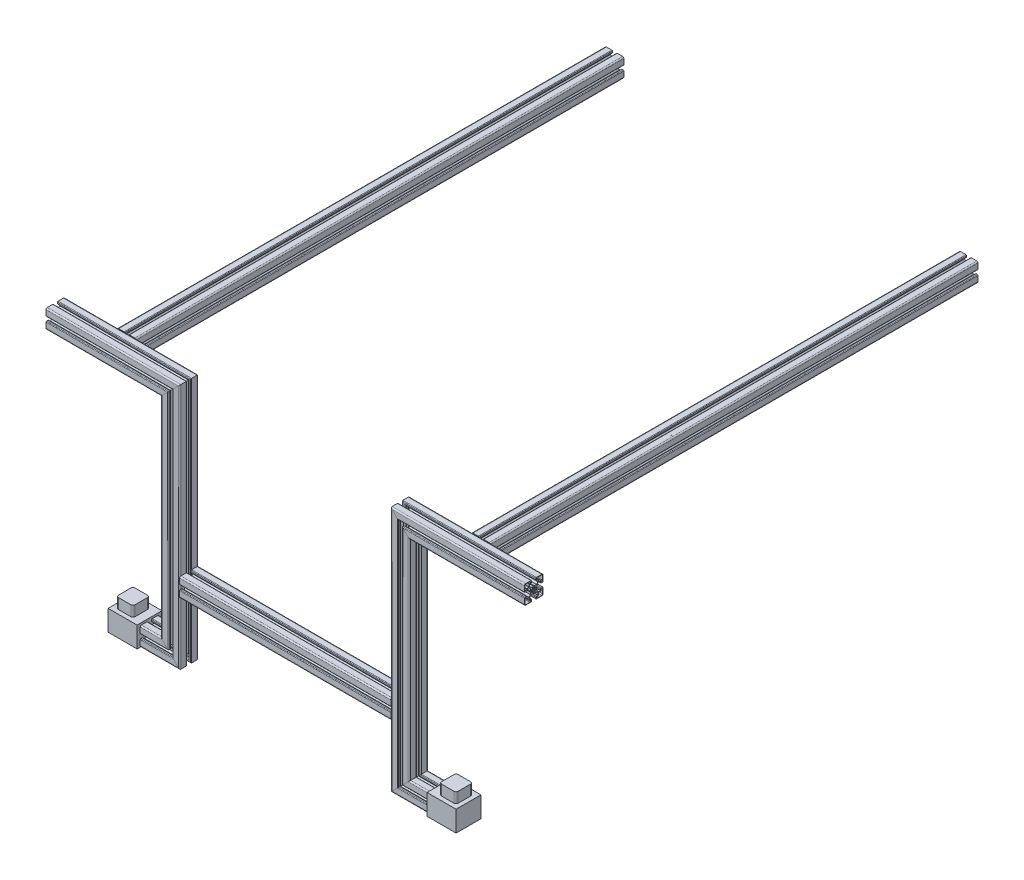
from build123d import *

# Parameters (mm, degrees)
SKETCH6_W            = 60
SKETCH6_H            = 50
BOSS_EXTRUDE3_DEPTH  = 70
SKETCH4_W            = 40
SKETCH4_H            = 40
RL_WHEEL_MOUNT_DEPTH = 25
FILLET1_R            = 5
BOSS_EXTRUDE5_DEPTH  = 254.9375
BOSS_EXTRUDE6_DEPTH  = 1177.476521782
FILLET1_OF_MIRROR2_R = 5


with BuildPart() as part:
    # Sweep3: sweep along a curve in space
    with BuildLine() as sweep3_path:
        Line((-420, 0, 0), (-277.5, 0, 0))
        Line((-277.5, 550, 0), (-277.5, 0, 0))
        Line((-277.5, 550, 0), (-577.5, 550, 0))
    # Sketch10 → Sweep3 (sweep)
    with BuildSketch(Plane(origin=(-420, 0, 0), x_dir=(0, 0, -1), z_dir=(1, 0, 0))):
        with BuildLine():
            Line((0.923478145, 7.9175), (0.023478218, 7.402351956))
            Line((0.023478218, 7.402351956), (-0.876521708, 7.9175))
            Line((-0.876521708, 7.9175), (-6.179846099, 7.9175))
            ThreePointArc((-6.179846099, 7.9175), (-6.325265803, 7.946425778), (-6.448546676, 8.028799423))
            Line((-6.448546676, 8.028799423), (-9.915222358, 11.495475106))
            ThreePointArc((-9.915222358, 11.495475106), (-9.997596004, 11.618755978), (-10.026521782, 11.764175683))
            Line((-10.026521782, 11.764175683), (-10.026521782, 16.0575))
            ThreePointArc((-10.026521782, 16.0575), (-9.915222358, 16.326200577), (-9.646521782, 16.4375))
            Line((-9.646521782, 16.4375), (-6.561521782, 16.4375))
            ThreePointArc((-6.561521782, 16.4375), (-5.486719474, 16.882697693), (-5.041521782, 17.9575))
            Line((-5.041521782, 17.9575), (-5.041521782, 20.9175))
            ThreePointArc((-5.041521782, 20.9175), (-5.486719474, 21.992302307), (-6.561521782, 22.4375))
            Line((-6.561521782, 22.4375), (-19.476521782, 22.4375))
            ThreePointArc((-19.476521782, 22.4375), (-21.597842125, 21.558820344), (-22.476521782, 19.4375))
            Line((-22.476521782, 19.4375), (-22.476521782, 6.5225))
            ThreePointArc((-22.476521782, 6.5225), (-22.031324089, 5.447697693), (-20.956521782, 5.0025))
            Line((-20.956521782, 5.0025), (-17.996521782, 5.0025))
            ThreePointArc((-17.996521782, 5.0025), (-16.921719474, 5.447697693), (-16.476521782, 6.5225))
            Line((-16.476521782, 6.5225), (-16.476521782, 9.6075))
            ThreePointArc((-16.476521782, 9.6075), (-16.365222358, 9.876200577), (-16.096521782, 9.9875))
            Line((-16.096521782, 9.9875), (-11.796126396, 9.9875))
            ThreePointArc((-11.796126396, 9.9875), (-11.650706692, 9.958574222), (-11.52742582, 9.876200577))
            Line((-11.52742582, 9.876200577), (-8.067821205, 6.416595962))
            ThreePointArc((-8.067821205, 6.416595962), (-7.985447559, 6.293315089), (-7.956521782, 6.147895385))
            Line((-7.956521782, 6.147895385), (-7.956521782, 0.837499635))
            Line((-7.956521782, 0.837499635), (-7.436908512, -0.0625))
            Line((-7.436908512, -0.0625), (-7.956521782, -0.962499635))
            Line((-7.956521782, -0.962499635), (-7.956521782, -6.265824317))
            ThreePointArc((-7.956521782, -6.265824317), (-7.985447559, -6.411244022), (-8.067821205, -6.534524894))
            Line((-8.067821205, -6.534524894), (-11.534496887, -10.001200577))
            ThreePointArc((-11.534496887, -10.001200577), (-11.65777776, -10.083574222), (-11.803197464, -10.1125))
            Line((-11.803197464, -10.1125), (-16.096521782, -10.1125))
            ThreePointArc((-16.096521782, -10.1125), (-16.365222358, -10.001200577), (-16.476521782, -9.7325))
            Line((-16.476521782, -9.7325), (-16.476521782, -6.6475))
            ThreePointArc((-16.476521782, -6.6475), (-16.921719474, -5.572697693), (-17.996521782, -5.1275))
            Line((-17.996521782, -5.1275), (-20.956521782, -5.1275))
            ThreePointArc((-20.956521782, -5.1275), (-22.031324089, -5.572697693), (-22.476521782, -6.6475))
            Line((-22.476521782, -6.6475), (-22.476521782, -19.5625))
            ThreePointArc((-22.476521782, -19.5625), (-21.597842125, -21.683820344), (-19.476521782, -22.5625))
            Line((-19.476521782, -22.5625), (-6.561521782, -22.5625))
            ThreePointArc((-6.561521782, -22.5625), (-5.486719474, -22.117302307), (-5.041521782, -21.0425))
            Line((-5.041521782, -21.0425), (-5.041521782, -18.0825))
            ThreePointArc((-5.041521782, -18.0825), (-5.486719474, -17.007697693), (-6.561521782, -16.5625))
            Line((-6.561521782, -16.5625), (-9.646521782, -16.5625))
            ThreePointArc((-9.646521782, -16.5625), (-9.915222358, -16.451200577), (-10.026521782, -16.1825))
            Line((-10.026521782, -16.1825), (-10.026521782, -11.882104615))
            ThreePointArc((-10.026521782, -11.882104615), (-9.997596004, -11.736684911), (-9.915222358, -11.613404038))
            Line((-9.915222358, -11.613404038), (-6.455617744, -8.153799423))
            ThreePointArc((-6.455617744, -8.153799423), (-6.332336871, -8.071425778), (-6.186917167, -8.0425))
            Line((-6.186917167, -8.0425), (-0.876521708, -8.0425))
            Line((-0.876521708, -8.0425), (0.023478218, -7.527351956))
            Line((0.023478218, -7.527351956), (0.923478145, -8.0425))
            Line((0.923478145, -8.0425), (6.226802536, -8.0425))
            ThreePointArc((6.226802536, -8.0425), (6.37222224, -8.071425778), (6.495503113, -8.153799423))
            Line((6.495503113, -8.153799423), (9.962178795, -11.620475106))
            ThreePointArc((9.962178795, -11.620475106), (10.044552441, -11.743755978), (10.073478218, -11.889175683))
            Line((10.073478218, -11.889175683), (10.073478218, -16.1825))
            ThreePointArc((10.073478218, -16.1825), (9.962178795, -16.451200577), (9.693478218, -16.5625))
            Line((9.693478218, -16.5625), (6.608478218, -16.5625))
            ThreePointArc((6.608478218, -16.5625), (5.533675911, -17.007697693), (5.088478218, -18.0825))
            Line((5.088478218, -18.0825), (5.088478218, -21.0425))
            ThreePointArc((5.088478218, -21.0425), (5.533675911, -22.117302307), (6.608478218, -22.5625))
            Line((6.608478218, -22.5625), (19.523478218, -22.5625))
            ThreePointArc((19.523478218, -22.5625), (21.644798562, -21.683820344), (22.523478218, -19.5625))
            Line((22.523478218, -19.5625), (22.523478218, -6.6475))
            ThreePointArc((22.523478218, -6.6475), (22.078280526, -5.572697693), (21.003478218, -5.1275))
            Line((21.003478218, -5.1275), (18.043478218, -5.1275))
            ThreePointArc((18.043478218, -5.1275), (16.968675911, -5.572697693), (16.523478218, -6.6475))
            Line((16.523478218, -6.6475), (16.523478218, -9.7325))
            ThreePointArc((16.523478218, -9.7325), (16.412178795, -10.001200577), (16.143478218, -10.1125))
            Line((16.143478218, -10.1125), (11.843082833, -10.1125))
            ThreePointArc((11.843082833, -10.1125), (11.697663129, -10.083574222), (11.574382256, -10.001200577))
            Line((11.574382256, -10.001200577), (8.114777642, -6.541595962))
            ThreePointArc((8.114777642, -6.541595962), (8.032403996, -6.418315089), (8.003478218, -6.272895385))
            Line((8.003478218, -6.272895385), (8.003478218, -0.962499635))
            Line((8.003478218, -0.962499635), (7.483864949, -0.0625))
            Line((7.483864949, -0.0625), (8.003478218, 0.837499635))
            Line((8.003478218, 0.837499635), (8.003478218, 6.140824317))
            ThreePointArc((8.003478218, 6.140824317), (8.032403996, 6.286244022), (8.114777642, 6.409524894))
            Line((8.114777642, 6.409524894), (11.581453324, 9.876200577))
            ThreePointArc((11.581453324, 9.876200577), (11.704734197, 9.958574222), (11.850153901, 9.9875))
            Line((11.850153901, 9.9875), (16.143478218, 9.9875))
            ThreePointArc((16.143478218, 9.9875), (16.412178795, 9.876200577), (16.523478218, 9.6075))
            Line((16.523478218, 9.6075), (16.523478218, 6.5225))
            ThreePointArc((16.523478218, 6.5225), (16.968675911, 5.447697693), (18.043478218, 5.0025))
            Line((18.043478218, 5.0025), (21.003478218, 5.0025))
            ThreePointArc((21.003478218, 5.0025), (22.078280526, 5.447697693), (22.523478218, 6.5225))
            Line((22.523478218, 6.5225), (22.523478218, 19.4375))
            ThreePointArc((22.523478218, 19.4375), (21.644798562, 21.558820344), (19.523478218, 22.4375))
            Line((19.523478218, 22.4375), (6.608478218, 22.4375))
            ThreePointArc((6.608478218, 22.4375), (5.533675911, 21.992302307), (5.088478218, 20.9175))
            Line((5.088478218, 20.9175), (5.088478218, 17.9575))
            ThreePointArc((5.088478218, 17.9575), (5.533675911, 16.882697693), (6.608478218, 16.4375))
            Line((6.608478218, 16.4375), (9.693478218, 16.4375))
            ThreePointArc((9.693478218, 16.4375), (9.962178795, 16.326200577), (10.073478218, 16.0575))
            Line((10.073478218, 16.0575), (10.073478218, 11.757104615))
            ThreePointArc((10.073478218, 11.757104615), (10.044552441, 11.611684911), (9.962178795, 11.488404038))
            Line((9.962178795, 11.488404038), (6.50257418, 8.028799423))
            ThreePointArc((6.50257418, 8.028799423), (6.379293308, 7.946425778), (6.233873604, 7.9175))
            Line((6.233873604, 7.9175), (0.923478145, 7.9175))
        make_face()
        with BuildLine():
            Line((9.9875, 17.976521782), (9.5475, 17.976521782))
            ThreePointArc((9.5475, 17.976521782), (8.486839828, 18.41586161), (8.0475, 19.476521782))
            Line((8.0475, 19.476521782), (8.0475, 19.976521782))
            ThreePointArc((8.0475, 19.976521782), (8.486839828, 21.037181953), (9.5475, 21.476521782))
            Line((9.5475, 21.476521782), (19.1575, 21.476521782))
            ThreePointArc((19.1575, 21.476521782), (20.769703461, 20.808725243), (21.4375, 19.196521782))
            Line((21.4375, 19.196521782), (21.4375, 9.586521782))
            ThreePointArc((21.4375, 9.586521782), (20.998160172, 8.52586161), (19.9375, 8.086521782))
            Line((19.9375, 8.086521782), (19.4375, 8.086521782))
            ThreePointArc((19.4375, 8.086521782), (18.376839828, 8.52586161), (17.9375, 9.586521782))
            Line((17.9375, 9.586521782), (17.9375, 10.026521782))
            ThreePointArc((17.9375, 10.026521782), (17.644606781, 10.733628563), (16.9375, 11.026521782))
            Line((16.9375, 11.026521782), (11.3675, 11.026521782))
            ThreePointArc((11.3675, 11.026521782), (11.098799423, 11.137821205), (10.9875, 11.406521782))
            Line((10.9875, 11.406521782), (10.9875, 16.976521782))
            ThreePointArc((10.9875, 16.976521782), (10.694606781, 17.683628563), (9.9875, 17.976521782))
        make_face(mode=Mode.SUBTRACT)
        with BuildLine():
            Line((17.976521782, -9.9875), (17.976521782, -9.5475))
            ThreePointArc((17.976521782, -9.5475), (18.41586161, -8.486839828), (19.476521782, -8.0475))
            Line((19.476521782, -8.0475), (19.976521782, -8.0475))
            ThreePointArc((19.976521782, -8.0475), (21.037181953, -8.486839828), (21.476521782, -9.5475))
            Line((21.476521782, -9.5475), (21.476521782, -19.1575))
            ThreePointArc((21.476521782, -19.1575), (20.808725243, -20.769703461), (19.196521782, -21.4375))
            Line((19.196521782, -21.4375), (9.586521782, -21.4375))
            ThreePointArc((9.586521782, -21.4375), (8.52586161, -20.998160172), (8.086521782, -19.9375))
            Line((8.086521782, -19.9375), (8.086521782, -19.4375))
            ThreePointArc((8.086521782, -19.4375), (8.52586161, -18.376839828), (9.586521782, -17.9375))
            Line((9.586521782, -17.9375), (10.026521782, -17.9375))
            ThreePointArc((10.026521782, -17.9375), (10.733628563, -17.644606781), (11.026521782, -16.9375))
            Line((11.026521782, -16.9375), (11.026521782, -11.3675))
            ThreePointArc((11.026521782, -11.3675), (11.137821205, -11.098799423), (11.406521782, -10.9875))
            Line((11.406521782, -10.9875), (16.976521782, -10.9875))
            ThreePointArc((16.976521782, -10.9875), (17.683628563, -10.694606781), (17.976521782, -9.9875))
        make_face(mode=Mode.SUBTRACT)
        with BuildLine():
            Line((-9.9875, -17.976521782), (-9.5475, -17.976521782))
            ThreePointArc((-9.5475, -17.976521782), (-8.486839828, -18.41586161), (-8.0475, -19.476521782))
            Line((-8.0475, -19.476521782), (-8.0475, -19.976521782))
            ThreePointArc((-8.0475, -19.976521782), (-8.486839828, -21.037181953), (-9.5475, -21.476521782))
            Line((-9.5475, -21.476521782), (-19.1575, -21.476521782))
            ThreePointArc((-19.1575, -21.476521782), (-20.769703461, -20.808725243), (-21.4375, -19.196521782))
            Line((-21.4375, -19.196521782), (-21.4375, -9.586521782))
            ThreePointArc((-21.4375, -9.586521782), (-20.998160172, -8.52586161), (-19.9375, -8.086521782))
            Line((-19.9375, -8.086521782), (-19.4375, -8.086521782))
            ThreePointArc((-19.4375, -8.086521782), (-18.376839828, -8.52586161), (-17.9375, -9.586521782))
            Line((-17.9375, -9.586521782), (-17.9375, -10.026521782))
            ThreePointArc((-17.9375, -10.026521782), (-17.644606781, -10.733628563), (-16.9375, -11.026521782))
            Line((-16.9375, -11.026521782), (-11.3675, -11.026521782))
            ThreePointArc((-11.3675, -11.026521782), (-11.098799423, -11.137821205), (-10.9875, -11.406521782))
            Line((-10.9875, -11.406521782), (-10.9875, -16.976521782))
            ThreePointArc((-10.9875, -16.976521782), (-10.694606781, -17.683628563), (-9.9875, -17.976521782))
        make_face(mode=Mode.SUBTRACT)
        with BuildLine():
            Line((-2.153421963, -5.786383293), (-2.569167752, -5.614175749))
            ThreePointArc((-2.569167752, -5.614175749), (-3.15900173, -4.923126385), (-2.946067959, -4.03988658))
            ThreePointArc((-2.946067959, -4.03988658), (-3.53563468, -3.535433129), (-4.040054521, -2.945837651))
            ThreePointArc((-4.040054521, -2.945837651), (-4.923275055, -3.158717363), (-5.614290138, -2.568891593))
            Line((-5.614290138, -2.568891593), (-5.786497682, -2.153145803))
            ThreePointArc((-5.786497682, -2.153145803), (-5.714927596, -1.247424507), (-4.939815828, -0.773446564))
            ThreePointArc((-4.939815828, -0.773446564), (-4.999999998, 0.000142518), (-4.939771728, 0.773728168))
            ThreePointArc((-4.939771728, 0.773728168), (-5.714831644, 1.24773071), (-5.786383293, 2.153421963))
            Line((-5.786383293, 2.153421963), (-5.614175749, 2.569167752))
            ThreePointArc((-5.614175749, 2.569167752), (-4.923126385, 3.15900173), (-4.03988658, 2.946067959))
            ThreePointArc((-4.03988658, 2.946067959), (-3.535433129, 3.53563468), (-2.945837651, 4.040054521))
            ThreePointArc((-2.945837651, 4.040054521), (-3.158717363, 4.923275055), (-2.568891593, 5.614290138))
            Line((-2.568891593, 5.614290138), (-2.153145803, 5.786497682))
            ThreePointArc((-2.153145803, 5.786497682), (-1.247424507, 5.714927596), (-0.773446564, 4.939815828))
            ThreePointArc((-0.773446564, 4.939815828), (0.000142518, 4.999999998), (0.773728168, 4.939771728))
            ThreePointArc((0.773728168, 4.939771728), (1.24773071, 5.714831644), (2.153421963, 5.786383293))
            Line((2.153421963, 5.786383293), (2.569167752, 5.614175749))
            ThreePointArc((2.569167752, 5.614175749), (3.15900173, 4.923126385), (2.946067959, 4.03988658))
            ThreePointArc((2.946067959, 4.03988658), (3.53563468, 3.535433129), (4.040054521, 2.945837651))
            ThreePointArc((4.040054521, 2.945837651), (4.923275055, 3.158717363), (5.614290138, 2.568891593))
            Line((5.614290138, 2.568891593), (5.786497682, 2.153145803))
            ThreePointArc((5.786497682, 2.153145803), (5.714927596, 1.247424507), (4.939815828, 0.773446564))
            ThreePointArc((4.939815828, 0.773446564), (4.999999998, -0.000142518), (4.939771728, -0.773728168))
            ThreePointArc((4.939771728, -0.773728168), (5.714831644, -1.24773071), (5.786383293, -2.153421963))
            Line((5.786383293, -2.153421963), (5.614175749, -2.569167752))
            ThreePointArc((5.614175749, -2.569167752), (4.923126385, -3.15900173), (4.03988658, -2.946067959))
            ThreePointArc((4.03988658, -2.946067959), (3.535433129, -3.53563468), (2.945837651, -4.040054521))
            ThreePointArc((2.945837651, -4.040054521), (3.158717363, -4.923275055), (2.568891593, -5.614290138))
            Line((2.568891593, -5.614290138), (2.153145803, -5.786497682))
            ThreePointArc((2.153145803, -5.786497682), (1.247424507, -5.714927596), (0.773446564, -4.939815828))
            ThreePointArc((0.773446564, -4.939815828), (-0.000142518, -4.999999998), (-0.773728168, -4.939771728))
            ThreePointArc((-0.773728168, -4.939771728), (-1.24773071, -5.714831644), (-2.153421963, -5.786383293))
        make_face(mode=Mode.SUBTRACT)
        with BuildLine():
            Line((-17.976521782, 9.9875), (-17.976521782, 9.5475))
            ThreePointArc((-17.976521782, 9.5475), (-18.41586161, 8.486839828), (-19.476521782, 8.0475))
            Line((-19.476521782, 8.0475), (-19.976521782, 8.0475))
            ThreePointArc((-19.976521782, 8.0475), (-21.037181953, 8.486839828), (-21.476521782, 9.5475))
            Line((-21.476521782, 9.5475), (-21.476521782, 19.1575))
            ThreePointArc((-21.476521782, 19.1575), (-20.808725243, 20.769703461), (-19.196521782, 21.4375))
            Line((-19.196521782, 21.4375), (-9.586521782, 21.4375))
            ThreePointArc((-9.586521782, 21.4375), (-8.52586161, 20.998160172), (-8.086521782, 19.9375))
            Line((-8.086521782, 19.9375), (-8.086521782, 19.4375))
            ThreePointArc((-8.086521782, 19.4375), (-8.52586161, 18.376839828), (-9.586521782, 17.9375))
            Line((-9.586521782, 17.9375), (-10.026521782, 17.9375))
            ThreePointArc((-10.026521782, 17.9375), (-10.733628563, 17.644606781), (-11.026521782, 16.9375))
            Line((-11.026521782, 16.9375), (-11.026521782, 11.3675))
            ThreePointArc((-11.026521782, 11.3675), (-11.137821205, 11.098799423), (-11.406521782, 10.9875))
            Line((-11.406521782, 10.9875), (-16.976521782, 10.9875))
            ThreePointArc((-16.976521782, 10.9875), (-17.683628563, 10.694606781), (-17.976521782, 9.9875))
        make_face(mode=Mode.SUBTRACT)
    sweep3 = sweep(path=sweep3_path.line, transition=Transition.RIGHT)

    # Sketch6 → Boss-Extrude3 (add)
    with BuildSketch(Plane.ZY.offset(420)):
        with Locations((0, 2.4375)):
            Rectangle(SKETCH6_W, SKETCH6_H)
    boss_extrude3 = extrude(amount=-BOSS_EXTRUDE3_DEPTH)

    # Sketch4 → RL Wheel Mount (add)
    with BuildSketch(Plane(origin=(0, 27.4375, 0), x_dir=(1, 0, 0), z_dir=(0, 1, 0))):
        with Locations((-390, 0)):
            Rectangle(SKETCH4_W, SKETCH4_H)
    rl_wheel_mount = extrude(amount=RL_WHEEL_MOUNT_DEPTH)

    # Fillet1
    fillet1_edges = [part.edges().sort_by_distance(p)[0] for p in [
        (-370, 39.9375, 20),
        (-370, 39.9375, -20),
        (-410, 39.9375, -20),
        (-410, 39.9375, 20),
    ]]
    fillet(fillet1_edges, radius=FILLET1_R)

    # Sketch12 → Boss-Extrude5 (add)
    with BuildSketch(Plane(origin=(0, 0, 0), x_dir=(0, 0, -1), z_dir=(1, 0, 0))):
        with BuildLine():
            Line((0.923478145, 157.9175), (0.023478218, 157.402351956))
            Line((0.023478218, 157.402351956), (-0.876521708, 157.9175))
            Line((-0.876521708, 157.9175), (-6.179846099, 157.9175))
            ThreePointArc((-6.179846099, 157.9175), (-6.325265803, 157.946425778), (-6.448546676, 158.028799423))
            Line((-6.448546676, 158.028799423), (-9.915222358, 161.495475106))
            ThreePointArc((-9.915222358, 161.495475106), (-9.997596004, 161.618755978), (-10.026521782, 161.764175683))
            Line((-10.026521782, 161.764175683), (-10.026521782, 166.0575))
            ThreePointArc((-10.026521782, 166.0575), (-9.915222358, 166.326200577), (-9.646521782, 166.4375))
            Line((-9.646521782, 166.4375), (-6.561521782, 166.4375))
            ThreePointArc((-6.561521782, 166.4375), (-5.486719474, 166.882697693), (-5.041521782, 167.9575))
            Line((-5.041521782, 167.9575), (-5.041521782, 170.9175))
            ThreePointArc((-5.041521782, 170.9175), (-5.486719474, 171.992302307), (-6.561521782, 172.4375))
            Line((-6.561521782, 172.4375), (-19.476521782, 172.4375))
            ThreePointArc((-19.476521782, 172.4375), (-21.597842125, 171.558820344), (-22.476521782, 169.4375))
            Line((-22.476521782, 169.4375), (-22.476521782, 156.5225))
            ThreePointArc((-22.476521782, 156.5225), (-22.031324089, 155.447697693), (-20.956521782, 155.0025))
            Line((-20.956521782, 155.0025), (-17.996521782, 155.0025))
            ThreePointArc((-17.996521782, 155.0025), (-16.921719474, 155.447697693), (-16.476521782, 156.5225))
            Line((-16.476521782, 156.5225), (-16.476521782, 159.6075))
            ThreePointArc((-16.476521782, 159.6075), (-16.365222358, 159.876200577), (-16.096521782, 159.9875))
            Line((-16.096521782, 159.9875), (-11.796126396, 159.9875))
            ThreePointArc((-11.796126396, 159.9875), (-11.650706692, 159.958574222), (-11.52742582, 159.876200577))
            Line((-11.52742582, 159.876200577), (-8.067821205, 156.416595962))
            ThreePointArc((-8.067821205, 156.416595962), (-7.985447559, 156.293315089), (-7.956521782, 156.147895385))
            Line((-7.956521782, 156.147895385), (-7.956521782, 150.837499635))
            Line((-7.956521782, 150.837499635), (-7.436908512, 149.9375))
            Line((-7.436908512, 149.9375), (-7.956521782, 149.037500365))
            Line((-7.956521782, 149.037500365), (-7.956521782, 143.734175683))
            ThreePointArc((-7.956521782, 143.734175683), (-7.985447559, 143.588755978), (-8.067821205, 143.465475106))
            Line((-8.067821205, 143.465475106), (-11.534496887, 139.998799423))
            ThreePointArc((-11.534496887, 139.998799423), (-11.65777776, 139.916425778), (-11.803197464, 139.8875))
            Line((-11.803197464, 139.8875), (-16.096521782, 139.8875))
            ThreePointArc((-16.096521782, 139.8875), (-16.365222358, 139.998799423), (-16.476521782, 140.2675))
            Line((-16.476521782, 140.2675), (-16.476521782, 143.3525))
            ThreePointArc((-16.476521782, 143.3525), (-16.921719474, 144.427302307), (-17.996521782, 144.8725))
            Line((-17.996521782, 144.8725), (-20.956521782, 144.8725))
            ThreePointArc((-20.956521782, 144.8725), (-22.031324089, 144.427302307), (-22.476521782, 143.3525))
            Line((-22.476521782, 143.3525), (-22.476521782, 130.4375))
            ThreePointArc((-22.476521782, 130.4375), (-21.597842125, 128.316179656), (-19.476521782, 127.4375))
            Line((-19.476521782, 127.4375), (-6.561521782, 127.4375))
            ThreePointArc((-6.561521782, 127.4375), (-5.486719474, 127.882697693), (-5.041521782, 128.9575))
            Line((-5.041521782, 128.9575), (-5.041521782, 131.9175))
            ThreePointArc((-5.041521782, 131.9175), (-5.486719474, 132.992302307), (-6.561521782, 133.4375))
            Line((-6.561521782, 133.4375), (-9.646521782, 133.4375))
            ThreePointArc((-9.646521782, 133.4375), (-9.915222358, 133.548799423), (-10.026521782, 133.8175))
            Line((-10.026521782, 133.8175), (-10.026521782, 138.117895385))
            ThreePointArc((-10.026521782, 138.117895385), (-9.997596004, 138.263315089), (-9.915222358, 138.386595962))
            Line((-9.915222358, 138.386595962), (-6.455617744, 141.846200577))
            ThreePointArc((-6.455617744, 141.846200577), (-6.332336871, 141.928574222), (-6.186917167, 141.9575))
            Line((-6.186917167, 141.9575), (-0.876521708, 141.9575))
            Line((-0.876521708, 141.9575), (0.023478218, 142.472648044))
            Line((0.023478218, 142.472648044), (0.923478145, 141.9575))
            Line((0.923478145, 141.9575), (6.226802536, 141.9575))
            ThreePointArc((6.226802536, 141.9575), (6.37222224, 141.928574222), (6.495503113, 141.846200577))
            Line((6.495503113, 141.846200577), (9.962178795, 138.379524894))
            ThreePointArc((9.962178795, 138.379524894), (10.044552441, 138.256244022), (10.073478218, 138.110824317))
            Line((10.073478218, 138.110824317), (10.073478218, 133.8175))
            ThreePointArc((10.073478218, 133.8175), (9.962178795, 133.548799423), (9.693478218, 133.4375))
            Line((9.693478218, 133.4375), (6.608478218, 133.4375))
            ThreePointArc((6.608478218, 133.4375), (5.533675911, 132.992302307), (5.088478218, 131.9175))
            Line((5.088478218, 131.9175), (5.088478218, 128.9575))
            ThreePointArc((5.088478218, 128.9575), (5.533675911, 127.882697693), (6.608478218, 127.4375))
            Line((6.608478218, 127.4375), (19.523478218, 127.4375))
            ThreePointArc((19.523478218, 127.4375), (21.644798562, 128.316179656), (22.523478218, 130.4375))
            Line((22.523478218, 130.4375), (22.523478218, 143.3525))
            ThreePointArc((22.523478218, 143.3525), (22.078280526, 144.427302307), (21.003478218, 144.8725))
            Line((21.003478218, 144.8725), (18.043478218, 144.8725))
            ThreePointArc((18.043478218, 144.8725), (16.968675911, 144.427302307), (16.523478218, 143.3525))
            Line((16.523478218, 143.3525), (16.523478218, 140.2675))
            ThreePointArc((16.523478218, 140.2675), (16.412178795, 139.998799423), (16.143478218, 139.8875))
            Line((16.143478218, 139.8875), (11.843082833, 139.8875))
            ThreePointArc((11.843082833, 139.8875), (11.697663129, 139.916425778), (11.574382256, 139.998799423))
            Line((11.574382256, 139.998799423), (8.114777642, 143.458404038))
            ThreePointArc((8.114777642, 143.458404038), (8.032403996, 143.581684911), (8.003478218, 143.727104615))
            Line((8.003478218, 143.727104615), (8.003478218, 149.037500365))
            Line((8.003478218, 149.037500365), (7.483864949, 149.9375))
            Line((7.483864949, 149.9375), (8.003478218, 150.837499635))
            Line((8.003478218, 150.837499635), (8.003478218, 156.140824317))
            ThreePointArc((8.003478218, 156.140824317), (8.032403996, 156.286244022), (8.114777642, 156.409524894))
            Line((8.114777642, 156.409524894), (11.581453324, 159.876200577))
            ThreePointArc((11.581453324, 159.876200577), (11.704734197, 159.958574222), (11.850153901, 159.9875))
            Line((11.850153901, 159.9875), (16.143478218, 159.9875))
            ThreePointArc((16.143478218, 159.9875), (16.412178795, 159.876200577), (16.523478218, 159.6075))
            Line((16.523478218, 159.6075), (16.523478218, 156.5225))
            ThreePointArc((16.523478218, 156.5225), (16.968675911, 155.447697693), (18.043478218, 155.0025))
            Line((18.043478218, 155.0025), (21.003478218, 155.0025))
            ThreePointArc((21.003478218, 155.0025), (22.078280526, 155.447697693), (22.523478218, 156.5225))
            Line((22.523478218, 156.5225), (22.523478218, 169.4375))
            ThreePointArc((22.523478218, 169.4375), (21.644798562, 171.558820344), (19.523478218, 172.4375))
            Line((19.523478218, 172.4375), (6.608478218, 172.4375))
            ThreePointArc((6.608478218, 172.4375), (5.533675911, 171.992302307), (5.088478218, 170.9175))
            Line((5.088478218, 170.9175), (5.088478218, 167.9575))
            ThreePointArc((5.088478218, 167.9575), (5.533675911, 166.882697693), (6.608478218, 166.4375))
            Line((6.608478218, 166.4375), (9.693478218, 166.4375))
            ThreePointArc((9.693478218, 166.4375), (9.962178795, 166.326200577), (10.073478218, 166.0575))
            Line((10.073478218, 166.0575), (10.073478218, 161.757104615))
            ThreePointArc((10.073478218, 161.757104615), (10.044552441, 161.611684911), (9.962178795, 161.488404038))
            Line((9.962178795, 161.488404038), (6.50257418, 158.028799423))
            ThreePointArc((6.50257418, 158.028799423), (6.379293308, 157.946425778), (6.233873604, 157.9175))
            Line((6.233873604, 157.9175), (0.923478145, 157.9175))
        make_face()
        with BuildLine():
            Line((9.9875, 167.976521782), (9.5475, 167.976521782))
            ThreePointArc((9.5475, 167.976521782), (8.486839828, 168.41586161), (8.0475, 169.476521782))
            Line((8.0475, 169.476521782), (8.0475, 169.976521782))
            ThreePointArc((8.0475, 169.976521782), (8.486839828, 171.037181953), (9.5475, 171.476521782))
            Line((9.5475, 171.476521782), (19.1575, 171.476521782))
            ThreePointArc((19.1575, 171.476521782), (20.769703461, 170.808725243), (21.4375, 169.196521782))
            Line((21.4375, 169.196521782), (21.4375, 159.586521782))
            ThreePointArc((21.4375, 159.586521782), (20.998160172, 158.52586161), (19.9375, 158.086521782))
            Line((19.9375, 158.086521782), (19.4375, 158.086521782))
            ThreePointArc((19.4375, 158.086521782), (18.376839828, 158.52586161), (17.9375, 159.586521782))
            Line((17.9375, 159.586521782), (17.9375, 160.026521782))
            ThreePointArc((17.9375, 160.026521782), (17.644606781, 160.733628563), (16.9375, 161.026521782))
            Line((16.9375, 161.026521782), (11.3675, 161.026521782))
            ThreePointArc((11.3675, 161.026521782), (11.098799423, 161.137821205), (10.9875, 161.406521782))
            Line((10.9875, 161.406521782), (10.9875, 166.976521782))
            ThreePointArc((10.9875, 166.976521782), (10.694606781, 167.683628563), (9.9875, 167.976521782))
        make_face(mode=Mode.SUBTRACT)
        with BuildLine():
            Line((17.976521782, 140.0125), (17.976521782, 140.4525))
            ThreePointArc((17.976521782, 140.4525), (18.41586161, 141.513160172), (19.476521782, 141.9525))
            Line((19.476521782, 141.9525), (19.976521782, 141.9525))
            ThreePointArc((19.976521782, 141.9525), (21.037181953, 141.513160172), (21.476521782, 140.4525))
            Line((21.476521782, 140.4525), (21.476521782, 130.8425))
            ThreePointArc((21.476521782, 130.8425), (20.808725243, 129.230296539), (19.196521782, 128.5625))
            Line((19.196521782, 128.5625), (9.586521782, 128.5625))
            ThreePointArc((9.586521782, 128.5625), (8.52586161, 129.001839828), (8.086521782, 130.0625))
            Line((8.086521782, 130.0625), (8.086521782, 130.5625))
            ThreePointArc((8.086521782, 130.5625), (8.52586161, 131.623160172), (9.586521782, 132.0625))
            Line((9.586521782, 132.0625), (10.026521782, 132.0625))
            ThreePointArc((10.026521782, 132.0625), (10.733628563, 132.355393219), (11.026521782, 133.0625))
            Line((11.026521782, 133.0625), (11.026521782, 138.6325))
            ThreePointArc((11.026521782, 138.6325), (11.137821205, 138.901200577), (11.406521782, 139.0125))
            Line((11.406521782, 139.0125), (16.976521782, 139.0125))
            ThreePointArc((16.976521782, 139.0125), (17.683628563, 139.305393219), (17.976521782, 140.0125))
        make_face(mode=Mode.SUBTRACT)
        with BuildLine():
            Line((-9.9875, 132.023478218), (-9.5475, 132.023478218))
            ThreePointArc((-9.5475, 132.023478218), (-8.486839828, 131.58413839), (-8.0475, 130.523478218))
            Line((-8.0475, 130.523478218), (-8.0475, 130.023478218))
            ThreePointArc((-8.0475, 130.023478218), (-8.486839828, 128.962818047), (-9.5475, 128.523478218))
            Line((-9.5475, 128.523478218), (-19.1575, 128.523478218))
            ThreePointArc((-19.1575, 128.523478218), (-20.769703461, 129.191274757), (-21.4375, 130.803478218))
            Line((-21.4375, 130.803478218), (-21.4375, 140.413478218))
            ThreePointArc((-21.4375, 140.413478218), (-20.998160172, 141.47413839), (-19.9375, 141.913478218))
            Line((-19.9375, 141.913478218), (-19.4375, 141.913478218))
            ThreePointArc((-19.4375, 141.913478218), (-18.376839828, 141.47413839), (-17.9375, 140.413478218))
            Line((-17.9375, 140.413478218), (-17.9375, 139.973478218))
            ThreePointArc((-17.9375, 139.973478218), (-17.644606781, 139.266371437), (-16.9375, 138.973478218))
            Line((-16.9375, 138.973478218), (-11.3675, 138.973478218))
            ThreePointArc((-11.3675, 138.973478218), (-11.098799423, 138.862178795), (-10.9875, 138.593478218))
            Line((-10.9875, 138.593478218), (-10.9875, 133.023478218))
            ThreePointArc((-10.9875, 133.023478218), (-10.694606781, 132.316371437), (-9.9875, 132.023478218))
        make_face(mode=Mode.SUBTRACT)
        with BuildLine():
            Line((-2.153421963, 144.213616707), (-2.569167752, 144.385824251))
            ThreePointArc((-2.569167752, 144.385824251), (-3.15900173, 145.076873615), (-2.946067959, 145.96011342))
            ThreePointArc((-2.946067959, 145.96011342), (-3.53563468, 146.464566871), (-4.040054521, 147.054162349))
            ThreePointArc((-4.040054521, 147.054162349), (-4.923275055, 146.841282637), (-5.614290138, 147.431108407))
            Line((-5.614290138, 147.431108407), (-5.786497682, 147.846854197))
            ThreePointArc((-5.786497682, 147.846854197), (-5.714927596, 148.752575493), (-4.939815828, 149.226553436))
            ThreePointArc((-4.939815828, 149.226553436), (-4.999999998, 150.000142518), (-4.939771728, 150.773728168))
            ThreePointArc((-4.939771728, 150.773728168), (-5.714831644, 151.24773071), (-5.786383293, 152.153421963))
            Line((-5.786383293, 152.153421963), (-5.614175749, 152.569167752))
            ThreePointArc((-5.614175749, 152.569167752), (-4.923126385, 153.15900173), (-4.03988658, 152.946067959))
            ThreePointArc((-4.03988658, 152.946067959), (-3.535433129, 153.53563468), (-2.945837651, 154.040054521))
            ThreePointArc((-2.945837651, 154.040054521), (-3.158717363, 154.923275055), (-2.568891593, 155.614290138))
            Line((-2.568891593, 155.614290138), (-2.153145803, 155.786497682))
            ThreePointArc((-2.153145803, 155.786497682), (-1.247424507, 155.714927596), (-0.773446564, 154.939815828))
            ThreePointArc((-0.773446564, 154.939815828), (0.000142518, 154.999999998), (0.773728168, 154.939771728))
            ThreePointArc((0.773728168, 154.939771728), (1.24773071, 155.714831644), (2.153421963, 155.786383293))
            Line((2.153421963, 155.786383293), (2.569167752, 155.614175749))
            ThreePointArc((2.569167752, 155.614175749), (3.15900173, 154.923126385), (2.946067959, 154.03988658))
            ThreePointArc((2.946067959, 154.03988658), (3.53563468, 153.535433129), (4.040054521, 152.945837651))
            ThreePointArc((4.040054521, 152.945837651), (4.923275055, 153.158717363), (5.614290138, 152.568891593))
            Line((5.614290138, 152.568891593), (5.786497682, 152.153145803))
            ThreePointArc((5.786497682, 152.153145803), (5.714927596, 151.247424507), (4.939815828, 150.773446564))
            ThreePointArc((4.939815828, 150.773446564), (4.999999998, 149.999857482), (4.939771728, 149.226271832))
            ThreePointArc((4.939771728, 149.226271832), (5.714831644, 148.75226929), (5.786383293, 147.846578037))
            Line((5.786383293, 147.846578037), (5.614175749, 147.430832248))
            ThreePointArc((5.614175749, 147.430832248), (4.923126385, 146.84099827), (4.03988658, 147.053932041))
            ThreePointArc((4.03988658, 147.053932041), (3.535433129, 146.46436532), (2.945837651, 145.959945479))
            ThreePointArc((2.945837651, 145.959945479), (3.158717363, 145.076724945), (2.568891593, 144.385709862))
            Line((2.568891593, 144.385709862), (2.153145803, 144.213502318))
            ThreePointArc((2.153145803, 144.213502318), (1.247424507, 144.285072404), (0.773446564, 145.060184172))
            ThreePointArc((0.773446564, 145.060184172), (-0.000142518, 145.000000002), (-0.773728168, 145.060228272))
            ThreePointArc((-0.773728168, 145.060228272), (-1.24773071, 144.285168356), (-2.153421963, 144.213616707))
        make_face(mode=Mode.SUBTRACT)
        with BuildLine():
            Line((-17.976521782, 159.9875), (-17.976521782, 159.5475))
            ThreePointArc((-17.976521782, 159.5475), (-18.41586161, 158.486839828), (-19.476521782, 158.0475))
            Line((-19.476521782, 158.0475), (-19.976521782, 158.0475))
            ThreePointArc((-19.976521782, 158.0475), (-21.037181953, 158.486839828), (-21.476521782, 159.5475))
            Line((-21.476521782, 159.5475), (-21.476521782, 169.1575))
            ThreePointArc((-21.476521782, 169.1575), (-20.808725243, 170.769703461), (-19.196521782, 171.4375))
            Line((-19.196521782, 171.4375), (-9.586521782, 171.4375))
            ThreePointArc((-9.586521782, 171.4375), (-8.52586161, 170.998160172), (-8.086521782, 169.9375))
            Line((-8.086521782, 169.9375), (-8.086521782, 169.4375))
            ThreePointArc((-8.086521782, 169.4375), (-8.52586161, 168.376839828), (-9.586521782, 167.9375))
            Line((-9.586521782, 167.9375), (-10.026521782, 167.9375))
            ThreePointArc((-10.026521782, 167.9375), (-10.733628563, 167.644606781), (-11.026521782, 166.9375))
            Line((-11.026521782, 166.9375), (-11.026521782, 161.3675))
            ThreePointArc((-11.026521782, 161.3675), (-11.137821205, 161.098799423), (-11.406521782, 160.9875))
            Line((-11.406521782, 160.9875), (-16.976521782, 160.9875))
            ThreePointArc((-16.976521782, 160.9875), (-17.683628563, 160.694606781), (-17.976521782, 159.9875))
        make_face(mode=Mode.SUBTRACT)
    boss_extrude5 = extrude(amount=-BOSS_EXTRUDE5_DEPTH)

    # Sketch13 → Boss-Extrude6 (add)
    with BuildSketch(Plane(origin=(-427.5, 550, -1200), x_dir=(-1, 0, 0), z_dir=(0, 0, -1))):
        with BuildLine():
            Line((0.923478145, 7.9175), (0.023478218, 7.402351956))
            Line((0.023478218, 7.402351956), (-0.876521708, 7.9175))
            Line((-0.876521708, 7.9175), (-6.179846099, 7.9175))
            ThreePointArc((-6.179846099, 7.9175), (-6.325265803, 7.946425778), (-6.448546676, 8.028799423))
            Line((-6.448546676, 8.028799423), (-9.915222358, 11.495475106))
            ThreePointArc((-9.915222358, 11.495475106), (-9.997596004, 11.618755978), (-10.026521782, 11.764175683))
            Line((-10.026521782, 11.764175683), (-10.026521782, 16.0575))
            ThreePointArc((-10.026521782, 16.0575), (-9.915222358, 16.326200577), (-9.646521782, 16.4375))
            Line((-9.646521782, 16.4375), (-6.561521782, 16.4375))
            ThreePointArc((-6.561521782, 16.4375), (-5.486719474, 16.882697693), (-5.041521782, 17.9575))
            Line((-5.041521782, 17.9575), (-5.041521782, 20.9175))
            ThreePointArc((-5.041521782, 20.9175), (-5.486719474, 21.992302307), (-6.561521782, 22.4375))
            Line((-6.561521782, 22.4375), (-19.476521782, 22.4375))
            ThreePointArc((-19.476521782, 22.4375), (-21.597842125, 21.558820344), (-22.476521782, 19.4375))
            Line((-22.476521782, 19.4375), (-22.476521782, 6.5225))
            ThreePointArc((-22.476521782, 6.5225), (-22.031324089, 5.447697693), (-20.956521782, 5.0025))
            Line((-20.956521782, 5.0025), (-17.996521782, 5.0025))
            ThreePointArc((-17.996521782, 5.0025), (-16.921719474, 5.447697693), (-16.476521782, 6.5225))
            Line((-16.476521782, 6.5225), (-16.476521782, 9.6075))
            ThreePointArc((-16.476521782, 9.6075), (-16.365222358, 9.876200577), (-16.096521782, 9.9875))
            Line((-16.096521782, 9.9875), (-11.796126396, 9.9875))
            ThreePointArc((-11.796126396, 9.9875), (-11.650706692, 9.958574222), (-11.52742582, 9.876200577))
            Line((-11.52742582, 9.876200577), (-8.067821205, 6.416595962))
            ThreePointArc((-8.067821205, 6.416595962), (-7.985447559, 6.293315089), (-7.956521782, 6.147895385))
            Line((-7.956521782, 6.147895385), (-7.956521782, 0.837499635))
            Line((-7.956521782, 0.837499635), (-7.436908512, -0.0625))
            Line((-7.436908512, -0.0625), (-7.956521782, -0.962499635))
            Line((-7.956521782, -0.962499635), (-7.956521782, -6.265824317))
            ThreePointArc((-7.956521782, -6.265824317), (-7.985447559, -6.411244022), (-8.067821205, -6.534524894))
            Line((-8.067821205, -6.534524894), (-11.534496887, -10.001200577))
            ThreePointArc((-11.534496887, -10.001200577), (-11.65777776, -10.083574222), (-11.803197464, -10.1125))
            Line((-11.803197464, -10.1125), (-16.096521782, -10.1125))
            ThreePointArc((-16.096521782, -10.1125), (-16.365222358, -10.001200577), (-16.476521782, -9.7325))
            Line((-16.476521782, -9.7325), (-16.476521782, -6.6475))
            ThreePointArc((-16.476521782, -6.6475), (-16.921719474, -5.572697693), (-17.996521782, -5.1275))
            Line((-17.996521782, -5.1275), (-20.956521782, -5.1275))
            ThreePointArc((-20.956521782, -5.1275), (-22.031324089, -5.572697693), (-22.476521782, -6.6475))
            Line((-22.476521782, -6.6475), (-22.476521782, -19.5625))
            ThreePointArc((-22.476521782, -19.5625), (-21.597842125, -21.683820344), (-19.476521782, -22.5625))
            Line((-19.476521782, -22.5625), (-6.561521782, -22.5625))
            ThreePointArc((-6.561521782, -22.5625), (-5.486719474, -22.117302307), (-5.041521782, -21.0425))
            Line((-5.041521782, -21.0425), (-5.041521782, -18.0825))
            ThreePointArc((-5.041521782, -18.0825), (-5.486719474, -17.007697693), (-6.561521782, -16.5625))
            Line((-6.561521782, -16.5625), (-9.646521782, -16.5625))
            ThreePointArc((-9.646521782, -16.5625), (-9.915222358, -16.451200577), (-10.026521782, -16.1825))
            Line((-10.026521782, -16.1825), (-10.026521782, -11.882104615))
            ThreePointArc((-10.026521782, -11.882104615), (-9.997596004, -11.736684911), (-9.915222358, -11.613404038))
            Line((-9.915222358, -11.613404038), (-6.455617744, -8.153799423))
            ThreePointArc((-6.455617744, -8.153799423), (-6.332336871, -8.071425778), (-6.186917167, -8.0425))
            Line((-6.186917167, -8.0425), (-0.876521708, -8.0425))
            Line((-0.876521708, -8.0425), (0.023478218, -7.527351956))
            Line((0.023478218, -7.527351956), (0.923478145, -8.0425))
            Line((0.923478145, -8.0425), (6.226802536, -8.0425))
            ThreePointArc((6.226802536, -8.0425), (6.37222224, -8.071425778), (6.495503113, -8.153799423))
            Line((6.495503113, -8.153799423), (9.962178795, -11.620475106))
            ThreePointArc((9.962178795, -11.620475106), (10.044552441, -11.743755978), (10.073478218, -11.889175683))
            Line((10.073478218, -11.889175683), (10.073478218, -16.1825))
            ThreePointArc((10.073478218, -16.1825), (9.962178795, -16.451200577), (9.693478218, -16.5625))
            Line((9.693478218, -16.5625), (6.608478218, -16.5625))
            ThreePointArc((6.608478218, -16.5625), (5.533675911, -17.007697693), (5.088478218, -18.0825))
            Line((5.088478218, -18.0825), (5.088478218, -21.0425))
            ThreePointArc((5.088478218, -21.0425), (5.533675911, -22.117302307), (6.608478218, -22.5625))
            Line((6.608478218, -22.5625), (19.523478218, -22.5625))
            ThreePointArc((19.523478218, -22.5625), (21.644798562, -21.683820344), (22.523478218, -19.5625))
            Line((22.523478218, -19.5625), (22.523478218, -6.6475))
            ThreePointArc((22.523478218, -6.6475), (22.078280526, -5.572697693), (21.003478218, -5.1275))
            Line((21.003478218, -5.1275), (18.043478218, -5.1275))
            ThreePointArc((18.043478218, -5.1275), (16.968675911, -5.572697693), (16.523478218, -6.6475))
            Line((16.523478218, -6.6475), (16.523478218, -9.7325))
            ThreePointArc((16.523478218, -9.7325), (16.412178795, -10.001200577), (16.143478218, -10.1125))
            Line((16.143478218, -10.1125), (11.843082833, -10.1125))
            ThreePointArc((11.843082833, -10.1125), (11.697663129, -10.083574222), (11.574382256, -10.001200577))
            Line((11.574382256, -10.001200577), (8.114777642, -6.541595962))
            ThreePointArc((8.114777642, -6.541595962), (8.032403996, -6.418315089), (8.003478218, -6.272895385))
            Line((8.003478218, -6.272895385), (8.003478218, -0.962499635))
            Line((8.003478218, -0.962499635), (7.483864949, -0.0625))
            Line((7.483864949, -0.0625), (8.003478218, 0.837499635))
            Line((8.003478218, 0.837499635), (8.003478218, 6.140824317))
            ThreePointArc((8.003478218, 6.140824317), (8.032403996, 6.286244022), (8.114777642, 6.409524894))
            Line((8.114777642, 6.409524894), (11.581453324, 9.876200577))
            ThreePointArc((11.581453324, 9.876200577), (11.704734197, 9.958574222), (11.850153901, 9.9875))
            Line((11.850153901, 9.9875), (16.143478218, 9.9875))
            ThreePointArc((16.143478218, 9.9875), (16.412178795, 9.876200577), (16.523478218, 9.6075))
            Line((16.523478218, 9.6075), (16.523478218, 6.5225))
            ThreePointArc((16.523478218, 6.5225), (16.968675911, 5.447697693), (18.043478218, 5.0025))
            Line((18.043478218, 5.0025), (21.003478218, 5.0025))
            ThreePointArc((21.003478218, 5.0025), (22.078280526, 5.447697693), (22.523478218, 6.5225))
            Line((22.523478218, 6.5225), (22.523478218, 19.4375))
            ThreePointArc((22.523478218, 19.4375), (21.644798562, 21.558820344), (19.523478218, 22.4375))
            Line((19.523478218, 22.4375), (6.608478218, 22.4375))
            ThreePointArc((6.608478218, 22.4375), (5.533675911, 21.992302307), (5.088478218, 20.9175))
            Line((5.088478218, 20.9175), (5.088478218, 17.9575))
            ThreePointArc((5.088478218, 17.9575), (5.533675911, 16.882697693), (6.608478218, 16.4375))
            Line((6.608478218, 16.4375), (9.693478218, 16.4375))
            ThreePointArc((9.693478218, 16.4375), (9.962178795, 16.326200577), (10.073478218, 16.0575))
            Line((10.073478218, 16.0575), (10.073478218, 11.757104615))
            ThreePointArc((10.073478218, 11.757104615), (10.044552441, 11.611684911), (9.962178795, 11.488404038))
            Line((9.962178795, 11.488404038), (6.50257418, 8.028799423))
            ThreePointArc((6.50257418, 8.028799423), (6.379293308, 7.946425778), (6.233873604, 7.9175))
            Line((6.233873604, 7.9175), (0.923478145, 7.9175))
        make_face()
        with BuildLine():
            Line((9.9875, 17.976521782), (9.5475, 17.976521782))
            ThreePointArc((9.5475, 17.976521782), (8.486839828, 18.41586161), (8.0475, 19.476521782))
            Line((8.0475, 19.476521782), (8.0475, 19.976521782))
            ThreePointArc((8.0475, 19.976521782), (8.486839828, 21.037181953), (9.5475, 21.476521782))
            Line((9.5475, 21.476521782), (19.1575, 21.476521782))
            ThreePointArc((19.1575, 21.476521782), (20.769703461, 20.808725243), (21.4375, 19.196521782))
            Line((21.4375, 19.196521782), (21.4375, 9.586521782))
            ThreePointArc((21.4375, 9.586521782), (20.998160172, 8.52586161), (19.9375, 8.086521782))
            Line((19.9375, 8.086521782), (19.4375, 8.086521782))
            ThreePointArc((19.4375, 8.086521782), (18.376839828, 8.52586161), (17.9375, 9.586521782))
            Line((17.9375, 9.586521782), (17.9375, 10.026521782))
            ThreePointArc((17.9375, 10.026521782), (17.644606781, 10.733628563), (16.9375, 11.026521782))
            Line((16.9375, 11.026521782), (11.3675, 11.026521782))
            ThreePointArc((11.3675, 11.026521782), (11.098799423, 11.137821205), (10.9875, 11.406521782))
            Line((10.9875, 11.406521782), (10.9875, 16.976521782))
            ThreePointArc((10.9875, 16.976521782), (10.694606781, 17.683628563), (9.9875, 17.976521782))
        make_face(mode=Mode.SUBTRACT)
        with BuildLine():
            Line((17.976521782, -9.9875), (17.976521782, -9.5475))
            ThreePointArc((17.976521782, -9.5475), (18.41586161, -8.486839828), (19.476521782, -8.0475))
            Line((19.476521782, -8.0475), (19.976521782, -8.0475))
            ThreePointArc((19.976521782, -8.0475), (21.037181953, -8.486839828), (21.476521782, -9.5475))
            Line((21.476521782, -9.5475), (21.476521782, -19.1575))
            ThreePointArc((21.476521782, -19.1575), (20.808725243, -20.769703461), (19.196521782, -21.4375))
            Line((19.196521782, -21.4375), (9.586521782, -21.4375))
            ThreePointArc((9.586521782, -21.4375), (8.52586161, -20.998160172), (8.086521782, -19.9375))
            Line((8.086521782, -19.9375), (8.086521782, -19.4375))
            ThreePointArc((8.086521782, -19.4375), (8.52586161, -18.376839828), (9.586521782, -17.9375))
            Line((9.586521782, -17.9375), (10.026521782, -17.9375))
            ThreePointArc((10.026521782, -17.9375), (10.733628563, -17.644606781), (11.026521782, -16.9375))
            Line((11.026521782, -16.9375), (11.026521782, -11.3675))
            ThreePointArc((11.026521782, -11.3675), (11.137821205, -11.098799423), (11.406521782, -10.9875))
            Line((11.406521782, -10.9875), (16.976521782, -10.9875))
            ThreePointArc((16.976521782, -10.9875), (17.683628563, -10.694606781), (17.976521782, -9.9875))
        make_face(mode=Mode.SUBTRACT)
        with BuildLine():
            Line((-9.9875, -17.976521782), (-9.5475, -17.976521782))
            ThreePointArc((-9.5475, -17.976521782), (-8.486839828, -18.41586161), (-8.0475, -19.476521782))
            Line((-8.0475, -19.476521782), (-8.0475, -19.976521782))
            ThreePointArc((-8.0475, -19.976521782), (-8.486839828, -21.037181953), (-9.5475, -21.476521782))
            Line((-9.5475, -21.476521782), (-19.1575, -21.476521782))
            ThreePointArc((-19.1575, -21.476521782), (-20.769703461, -20.808725243), (-21.4375, -19.196521782))
            Line((-21.4375, -19.196521782), (-21.4375, -9.586521782))
            ThreePointArc((-21.4375, -9.586521782), (-20.998160172, -8.52586161), (-19.9375, -8.086521782))
            Line((-19.9375, -8.086521782), (-19.4375, -8.086521782))
            ThreePointArc((-19.4375, -8.086521782), (-18.376839828, -8.52586161), (-17.9375, -9.586521782))
            Line((-17.9375, -9.586521782), (-17.9375, -10.026521782))
            ThreePointArc((-17.9375, -10.026521782), (-17.644606781, -10.733628563), (-16.9375, -11.026521782))
            Line((-16.9375, -11.026521782), (-11.3675, -11.026521782))
            ThreePointArc((-11.3675, -11.026521782), (-11.098799423, -11.137821205), (-10.9875, -11.406521782))
            Line((-10.9875, -11.406521782), (-10.9875, -16.976521782))
            ThreePointArc((-10.9875, -16.976521782), (-10.694606781, -17.683628563), (-9.9875, -17.976521782))
        make_face(mode=Mode.SUBTRACT)
        with BuildLine():
            Line((-2.153421963, -5.786383293), (-2.569167752, -5.614175749))
            ThreePointArc((-2.569167752, -5.614175749), (-3.15900173, -4.923126385), (-2.946067959, -4.03988658))
            ThreePointArc((-2.946067959, -4.03988658), (-3.53563468, -3.535433129), (-4.040054521, -2.945837651))
            ThreePointArc((-4.040054521, -2.945837651), (-4.923275055, -3.158717363), (-5.614290138, -2.568891593))
            Line((-5.614290138, -2.568891593), (-5.786497682, -2.153145803))
            ThreePointArc((-5.786497682, -2.153145803), (-5.714927596, -1.247424507), (-4.939815828, -0.773446564))
            ThreePointArc((-4.939815828, -0.773446564), (-4.999999998, 0.000142518), (-4.939771728, 0.773728168))
            ThreePointArc((-4.939771728, 0.773728168), (-5.714831644, 1.24773071), (-5.786383293, 2.153421963))
            Line((-5.786383293, 2.153421963), (-5.614175749, 2.569167752))
            ThreePointArc((-5.614175749, 2.569167752), (-4.923126385, 3.15900173), (-4.03988658, 2.946067959))
            ThreePointArc((-4.03988658, 2.946067959), (-3.535433129, 3.53563468), (-2.945837651, 4.040054521))
            ThreePointArc((-2.945837651, 4.040054521), (-3.158717363, 4.923275055), (-2.568891593, 5.614290138))
            Line((-2.568891593, 5.614290138), (-2.153145803, 5.786497682))
            ThreePointArc((-2.153145803, 5.786497682), (-1.247424507, 5.714927596), (-0.773446564, 4.939815828))
            ThreePointArc((-0.773446564, 4.939815828), (0.000142518, 4.999999998), (0.773728168, 4.939771728))
            ThreePointArc((0.773728168, 4.939771728), (1.24773071, 5.714831644), (2.153421963, 5.786383293))
            Line((2.153421963, 5.786383293), (2.569167752, 5.614175749))
            ThreePointArc((2.569167752, 5.614175749), (3.15900173, 4.923126385), (2.946067959, 4.03988658))
            ThreePointArc((2.946067959, 4.03988658), (3.53563468, 3.535433129), (4.040054521, 2.945837651))
            ThreePointArc((4.040054521, 2.945837651), (4.923275055, 3.158717363), (5.614290138, 2.568891593))
            Line((5.614290138, 2.568891593), (5.786497682, 2.153145803))
            ThreePointArc((5.786497682, 2.153145803), (5.714927596, 1.247424507), (4.939815828, 0.773446564))
            ThreePointArc((4.939815828, 0.773446564), (4.999999998, -0.000142518), (4.939771728, -0.773728168))
            ThreePointArc((4.939771728, -0.773728168), (5.714831644, -1.24773071), (5.786383293, -2.153421963))
            Line((5.786383293, -2.153421963), (5.614175749, -2.569167752))
            ThreePointArc((5.614175749, -2.569167752), (4.923126385, -3.15900173), (4.03988658, -2.946067959))
            ThreePointArc((4.03988658, -2.946067959), (3.535433129, -3.53563468), (2.945837651, -4.040054521))
            ThreePointArc((2.945837651, -4.040054521), (3.158717363, -4.923275055), (2.568891593, -5.614290138))
            Line((2.568891593, -5.614290138), (2.153145803, -5.786497682))
            ThreePointArc((2.153145803, -5.786497682), (1.247424507, -5.714927596), (0.773446564, -4.939815828))
            ThreePointArc((0.773446564, -4.939815828), (-0.000142518, -4.999999998), (-0.773728168, -4.939771728))
            ThreePointArc((-0.773728168, -4.939771728), (-1.24773071, -5.714831644), (-2.153421963, -5.786383293))
        make_face(mode=Mode.SUBTRACT)
        with BuildLine():
            Line((-17.976521782, 9.9875), (-17.976521782, 9.5475))
            ThreePointArc((-17.976521782, 9.5475), (-18.41586161, 8.486839828), (-19.476521782, 8.0475))
            Line((-19.476521782, 8.0475), (-19.976521782, 8.0475))
            ThreePointArc((-19.976521782, 8.0475), (-21.037181953, 8.486839828), (-21.476521782, 9.5475))
            Line((-21.476521782, 9.5475), (-21.476521782, 19.1575))
            ThreePointArc((-21.476521782, 19.1575), (-20.808725243, 20.769703461), (-19.196521782, 21.4375))
            Line((-19.196521782, 21.4375), (-9.586521782, 21.4375))
            ThreePointArc((-9.586521782, 21.4375), (-8.52586161, 20.998160172), (-8.086521782, 19.9375))
            Line((-8.086521782, 19.9375), (-8.086521782, 19.4375))
            ThreePointArc((-8.086521782, 19.4375), (-8.52586161, 18.376839828), (-9.586521782, 17.9375))
            Line((-9.586521782, 17.9375), (-10.026521782, 17.9375))
            ThreePointArc((-10.026521782, 17.9375), (-10.733628563, 17.644606781), (-11.026521782, 16.9375))
            Line((-11.026521782, 16.9375), (-11.026521782, 11.3675))
            ThreePointArc((-11.026521782, 11.3675), (-11.137821205, 11.098799423), (-11.406521782, 10.9875))
            Line((-11.406521782, 10.9875), (-16.976521782, 10.9875))
            ThreePointArc((-16.976521782, 10.9875), (-17.683628563, 10.694606781), (-17.976521782, 9.9875))
        make_face(mode=Mode.SUBTRACT)
    boss_extrude6 = extrude(amount=-BOSS_EXTRUDE6_DEPTH)

    # Mirror2: Sweep3, Boss-Extrude3, RL Wheel Mount, Boss-Extrude5, Boss-Extrude6 across plane
    add(sweep3.mirror(Plane(origin=(0, 0, 0), x_dir=(0, 0, 1), z_dir=(1, 0, 0))))
    add(boss_extrude3.mirror(Plane(origin=(0, 0, 0), x_dir=(0, 0, 1), z_dir=(1, 0, 0))))
    add(rl_wheel_mount.mirror(Plane(origin=(0, 0, 0), x_dir=(0, 0, 1), z_dir=(1, 0, 0))))
    add(boss_extrude5.mirror(Plane(origin=(0, 0, 0), x_dir=(0, 0, 1), z_dir=(1, 0, 0))))
    add(boss_extrude6.mirror(Plane(origin=(0, 0, 0), x_dir=(0, 0, 1), z_dir=(1, 0, 0))))

    # Fillet1 of Mirror2
    fillet1_of_mirror2_edges = [part.edges().sort_by_distance(p)[0] for p in [
        (370, 39.9375, 20),
        (370, 39.9375, -20),
        (410, 39.9375, -20),
        (410, 39.9375, 20),
    ]]
    fillet(fillet1_of_mirror2_edges, radius=FILLET1_OF_MIRROR2_R)


solid = part.part
